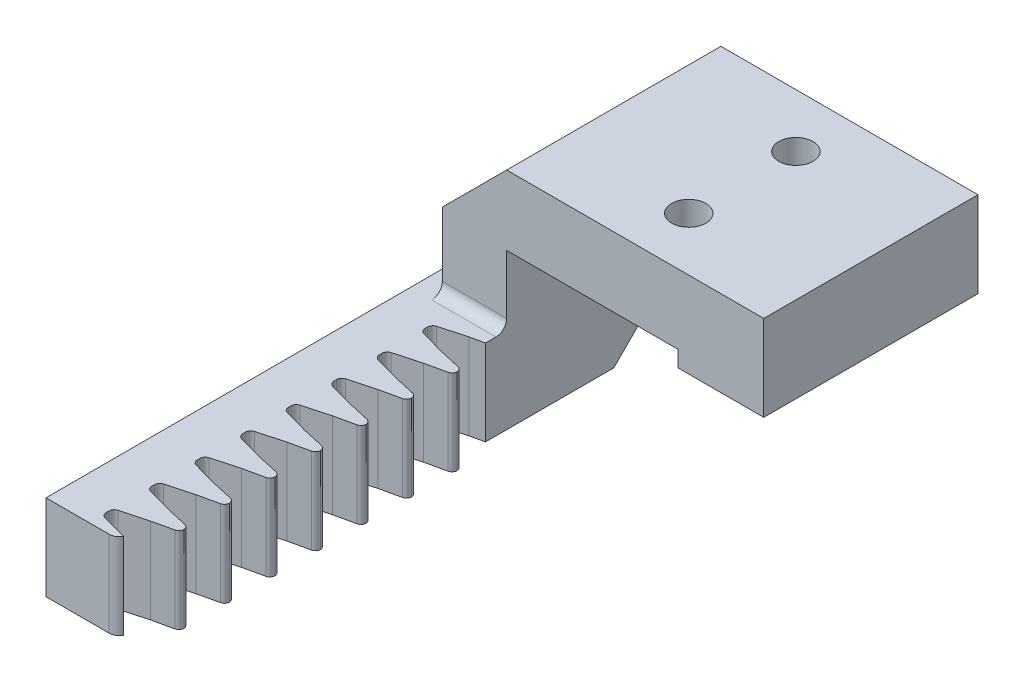
from build123d import *

# Parameters (mm, degrees)
SKETCH1_W           = 30
SKETCH1_H           = 16
BOSS_EXTRUDE1_DEPTH = 20
CUT_EXTRUDE1_DEPTH  = 20
SKETCH3_W           = 6
SKETCH3_H           = 10
BOSS_EXTRUDE2_DEPTH = 5
SKETCH9_R           = 1.6
CUT_EXTRUDE3_DEPTH  = 6.5
SKETCH11_W          = 10
SKETCH11_H          = 8
BOSS_EXTRUDE4_DEPTH = 40
CHAMFER2_SIZE2      = 10
CHAMFER2_SIZE       = 2
FILLET1_R           = 1
CUT_EXTRUDE4_DEPTH  = 8
SKETCH13_W          = 2
SKETCH13_H          = 8
BOSS_EXTRUDE5_DEPTH = 10
LPATTERN1_COUNT     = 8
LPATTERN1_PITCH     = 4.25
FILLET2_R           = 0.5
FILLET3_R           = 1
SKETCH14_W          = 2
SKETCH14_H          = 8
CUT_EXTRUDE5_DEPTH  = 17
CHAMFER3_SIZE       = 6
CHAMFER4_SIZE       = 5


# Some blends are built 0.0001 mm under size
with BuildPart() as part:
    # Sketch1 → Boss-Extrude1 (new body)
    with BuildSketch(Plane.XY):
        with Locations((15, -8)):
            Rectangle(SKETCH1_W, SKETCH1_H)
    extrude(amount=BOSS_EXTRUDE1_DEPTH)

    # Sketch2 → Cut-Extrude1 (cut)
    with BuildSketch(Plane.XY.offset(20)):
        Polygon((22, -6.5), (22, -8), (30, -8), (30, -16), (6, -16), (6, -6.5), align=None)
    extrude(amount=-CUT_EXTRUDE1_DEPTH, mode=Mode.SUBTRACT)

    # Sketch3 → Boss-Extrude2 (add)
    with BuildSketch(Plane.XZ.offset(16)):
        with Locations((3, 10)):
            Rectangle(SKETCH3_W, SKETCH3_H)
    extrude(amount=BOSS_EXTRUDE2_DEPTH)

    # Sketch9 → Cut-Extrude3 (cut)
    with BuildSketch(Plane.XZ.offset(6.5)):
        with Locations(Location((18, 15, 0), (0, 0, 270))):
            Circle(SKETCH9_R)
        with Locations(Location((18, 5, 0), (0, 0, 270))):
            Circle(SKETCH9_R)
    extrude(amount=-CUT_EXTRUDE3_DEPTH, mode=Mode.SUBTRACT)

    # Sketch11 → Boss-Extrude4 (add)
    with BuildSketch(Plane.XY.offset(15)):
        with Locations((3, -17)):
            Rectangle(SKETCH11_W, SKETCH11_H)
    extrude(amount=BOSS_EXTRUDE4_DEPTH)

    # Chamfer2
    chamfer2_edges = [part.edges().sort_by_distance(p)[0] for p in [
        (0, -17, 15),
    ]]
    chamfer2_side = [part.faces().sort_by_distance(p)[0] for p in [
        (-0.04, -17, 15),
    ]]
    chamfer(chamfer2_edges, length=CHAMFER2_SIZE - 0.0001, length2=CHAMFER2_SIZE2 - 0.0001, reference=chamfer2_side[0])  # a hair under: the kernel refuses the full size

    # Fillet1
    fillet1_edges = [part.edges().sort_by_distance(p)[0] for p in [
        (3, -13, 20),
    ]]
    fillet(fillet1_edges, radius=FILLET1_R)

    # Sketch12 → Cut-Extrude4 (cut)
    with BuildSketch(Plane.XZ.offset(21)):
        Polygon((7, 55), (4.75, 54.5), (2, 53.75), (2, 52.75), (4.75, 52), (7, 51.5), (7, 50.75), (8, 50.75), (8, 55), align=None)
    cut_extrude4 = extrude(amount=-CUT_EXTRUDE4_DEPTH, mode=Mode.SUBTRACT)

    # Sketch13 → Boss-Extrude5 (add)
    with BuildSketch(Plane(origin=(0, 0, 15), x_dir=(-1, 0, 0), z_dir=(0, 0, -1))):
        with Locations((-7, -17)):
            Rectangle(SKETCH13_W, SKETCH13_H)
    extrude(amount=BOSS_EXTRUDE5_DEPTH)

    # LPattern1: Cut-Extrude4 ×8
    with Locations(*[(0, 0, -i * LPATTERN1_PITCH) for i in range(1, LPATTERN1_COUNT)]):
        add(cut_extrude4, mode=Mode.SUBTRACT)

    # Fillet2
    # the kernel refuses this fillet: 0.5 mm, written as the material it adds along each edge
    with BuildSketch(Plane(origin=(2, -21, 52.75), x_dir=(0.9647638212377322, 0, -0.26311740579210835), z_dir=(0, 1, 0)), Plane(origin=(2, -21, 53.75), x_dir=(0, 0, -1), z_dir=(0, 1, 0)), Plane(origin=(2, -21, 48.5), x_dir=(0.9647638212377321, 0, -0.26311740579210924), z_dir=(0, 1, 0)), Plane(origin=(2, -21, 49.5), x_dir=(0, 0, -1), z_dir=(0, 1, 0)), Plane(origin=(2, -21, 44.25), x_dir=(0.9647638212377321, 0, -0.26311740579210924), z_dir=(0, 1, 0)), Plane(origin=(2, -21, 45.25), x_dir=(0, 0, -1), z_dir=(0, 1, 0)), Plane(origin=(2, -21, 35.75), x_dir=(0.9647638212377321, 0, -0.26311740579210896), z_dir=(0, 1, 0)), Plane(origin=(2, -21, 36.75), x_dir=(0, 0, -1), z_dir=(0, 1, 0)), Plane(origin=(2, -21, 40), x_dir=(0.9647638212377321, 0, -0.26311740579210924), z_dir=(0, 1, 0)), Plane(origin=(2, -21, 41), x_dir=(0, 0, -1), z_dir=(0, 1, 0)), Plane(origin=(2, -21, 23), x_dir=(0.9647638212377319, 0, -0.2631174057921095), z_dir=(0, 1, 0)), Plane(origin=(2, -21, 24), x_dir=(0, 0, -1), z_dir=(0, 1, 0)), Plane(origin=(2, -21, 27.25), x_dir=(0.9647638212377319, 0, -0.2631174057921095), z_dir=(0, 1, 0)), Plane(origin=(2, -21, 28.25), x_dir=(0, 0, -1), z_dir=(0, 1, 0)), Plane(origin=(2, -21, 32.5), x_dir=(0, 0, -1), z_dir=(0, 1, 0)), Plane(origin=(2, -21, 31.5), x_dir=(0.9647638212377319, 0, -0.2631174057921095), z_dir=(0, 1, 0))) as fillet2_piece_1:
        with BuildLine():
            CenterArc((FILLET2_R * 0.763795840999, -FILLET2_R), FILLET2_R, 90, 74.744881297)
            Line((-FILLET2_R * 0.200967980239, -FILLET2_R * 0.736882594208), (0, 0))
            Line((0, 0), (FILLET2_R * 0.763795840999, 0))
        make_face()
    extrude(amount=8)
    # the kernel refuses this fillet: 0.5 mm, written as the material it takes off along each edge
    with BuildSketch(Plane(origin=(7, -22.002714508, 33.75), x_dir=(-0.9761870601839541, 0, -0.21693045781865056), z_dir=(0, 1, 0)), Plane(origin=(7, -22.002714508, 34.5), x_dir=(0, 0, -1), z_dir=(0, 1, 0)), Plane(origin=(7, -22.002714508, 38), x_dir=(-0.9761870601839535, 0, -0.21693045781865242), z_dir=(0, 1, 0)), Plane(origin=(7, -22.002714508, 38.75), x_dir=(0, 0, -1), z_dir=(0, 1, 0)), Plane(origin=(7, -22.002714508, 42.25), x_dir=(-0.9761870601839538, 0, -0.216930457818651), z_dir=(0, 1, 0)), Plane(origin=(7, -22.002714508, 43), x_dir=(0, 0, -1), z_dir=(0, 1, 0)), Plane(origin=(7, -22.002714508, 46.5), x_dir=(-0.9761870601839538, 0, -0.216930457818651), z_dir=(0, 1, 0)), Plane(origin=(7, -22.002714508, 47.25), x_dir=(0, 0, -1), z_dir=(0, 1, 0)), Plane(origin=(7, -22.002714508, 50.75), x_dir=(-0.9761870601839538, 0, -0.216930457818651), z_dir=(0, 1, 0)), Plane(origin=(7, -22.002714508, 51.5), x_dir=(0, 0, -1), z_dir=(0, 1, 0)), Plane(origin=(7, -22.002714508, 25.25), x_dir=(-0.9761870601839521, 0, -0.21693045781865947), z_dir=(0, 1, 0)), Plane(origin=(7, -22.002714508, 26), x_dir=(0, 0, -1), z_dir=(0, 1, 0)), Plane(origin=(7, -22.002714508, 29.5), x_dir=(-0.9761870601839522, 0, -0.2169304578186585), z_dir=(0, 1, 0)), Plane(origin=(7, -22.002714508, 30.25), x_dir=(0, 0, -1), z_dir=(0, 1, 0))) as fillet2_2_piece_1:
        with BuildLine():
            CenterArc((FILLET2_R * 0.802171606366, FILLET2_R), FILLET2_R, 192.528807709, 77.471192291)
            Line((-FILLET2_R * 0.174015453818, FILLET2_R * 0.783069542181), (0, 0))
            Line((0, 0), (FILLET2_R * 0.802171606366, 0))
        make_face()
    extrude(amount=10.005429016, mode=Mode.SUBTRACT)

    # Fillet3
    # the kernel refuses this fillet: 1 mm, written as the material it takes off along each edge
    with BuildSketch(Plane(origin=(7, -28.790063509, 55), x_dir=(-1, 0, 0), z_dir=(0, 1, 0))) as fillet3_piece_1:
        with BuildLine():
            CenterArc((3.116025404, -1), FILLET3_R, 90, 60)
            Line((2.25, -0.5), (0, 0))
            Line((0, 0), (3.116025404, 0))
        make_face()
    extrude(amount=23.580127019, mode=Mode.SUBTRACT)

    # Sketch14 → Cut-Extrude5 (cut)
    with BuildSketch(Plane(origin=(0, 0, 5), x_dir=(-1, 0, 0), z_dir=(0, 0, -1))):
        with Locations((-7, -17)):
            Rectangle(SKETCH14_W, SKETCH14_H)
    extrude(amount=-CUT_EXTRUDE5_DEPTH, mode=Mode.SUBTRACT)

    # Chamfer3
    chamfer3_edges = [part.edges().sort_by_distance(p)[0] for p in [
        (0, 0, 10),
    ]]
    chamfer(chamfer3_edges, length=CHAMFER3_SIZE)

    # Chamfer4
    chamfer4_edges = [part.edges().sort_by_distance(p)[0] for p in [
        (3, -21, 5),
        (3, -16, 0),
    ]]
    chamfer(chamfer4_edges, length=CHAMFER4_SIZE - 0.0001)  # a hair under: the kernel refuses the full size


solid = part.part
